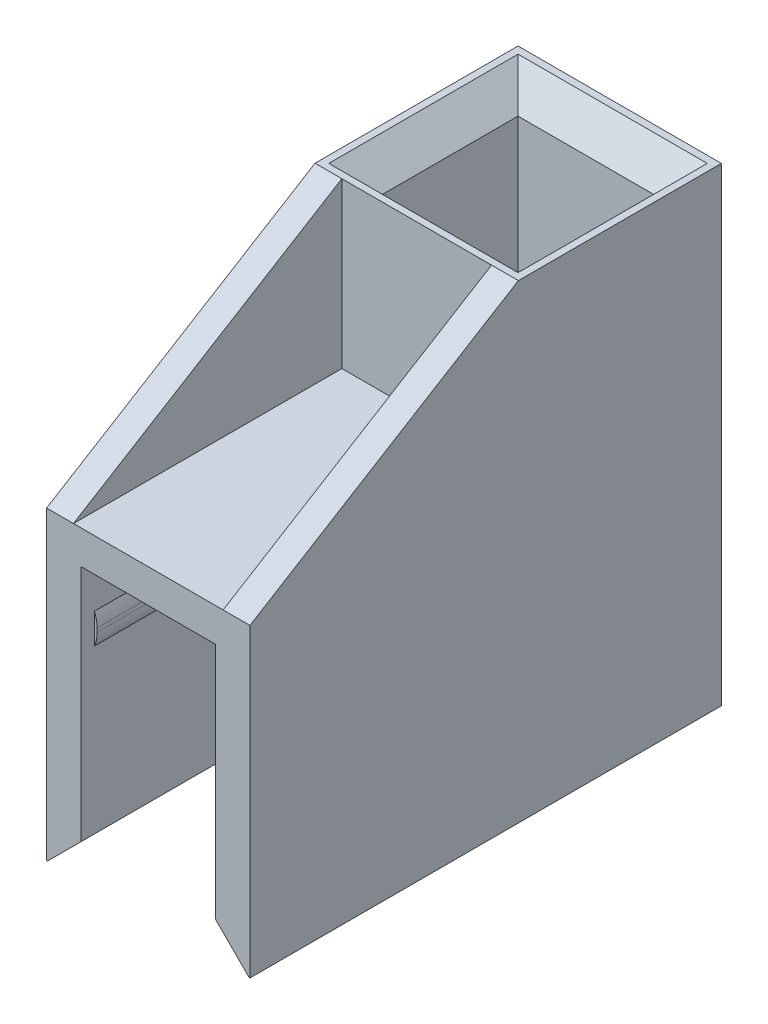
from build123d import *

# Parameters (mm, degrees)
CROQUIS2_W               = 30.3
CROQUIS2_H               = 70
SALIENTE_EXTRUIR2_DEPTH  = 5
SALIENTE_EXTRUIR3_START  = -20
SALIENTE_EXTRUIR3_DEPTH  = 70
SALIENTE_EXTRUIR4_START  = -20
CROQUIS4_W               = 20.2
CROQUIS4_H               = 20.2
SALIENTE_EXTRUIR4_DEPTH  = 4
CHAFL_N4_SIZE            = 4
CROQUIS6_W               = 30.3
CROQUIS6_H               = 5
CROQUIS6_W_2             = 5.125
CROQUIS6_H_2             = 40.5
SALIENTE_EXTRUIR6_DEPTH  = 40
SALIENTE_EXTRUIR7_START  = -15.15
SALIENTE_EXTRUIR7_DEPTH  = 30.3
CROQUIS8_W               = 22.3
CROQUIS8_H               = 24.5
CORTAR_EXTRUIR1_DEPTH    = 40
CHAFL_N9_SIZE            = 5
SALIENTE_EXTRUIR9_DEPTH  = 0.4
REDONDEO3_R              = 5
SALIENTE_EXTRUIR10_DEPTH = 0.4
REDONDEO4_R              = 5


with BuildPart() as part:
    # Croquis2 → Saliente-Extruir2 (new body)
    with BuildSketch(Plane.XY):
        with Locations((0, 15)):
            Rectangle(CROQUIS2_W, CROQUIS2_H)
    extrude(amount=-SALIENTE_EXTRUIR2_DEPTH)

    # Croquis3 → Saliente-Extruir3 (add)
    with BuildSketch(Plane(origin=(0, 0, 0), x_dir=(1, 0, 0), z_dir=(0, 1, 0)).offset(SALIENTE_EXTRUIR3_START)):
        Polygon((-15.15, 30.25), (-15.15, 5), (-10.1, 5), (-10.1, 25.2), (10.1, 25.2), (10.1, 5), (15.15, 5), (15.15, 30.25), align=None)
    extrude(amount=SALIENTE_EXTRUIR3_DEPTH)

    # Croquis4 → Saliente-Extruir4 (add)
    with BuildSketch(Plane(origin=(0, 0, 0), x_dir=(1, 0, 0), z_dir=(0, 1, 0)).offset(SALIENTE_EXTRUIR4_START)):
        with Locations((0, 15.1)):
            Rectangle(CROQUIS4_W, CROQUIS4_H)
    extrude(amount=SALIENTE_EXTRUIR4_DEPTH)

    # Chaflán4
    chafl_n4_edges = [part.edges().sort_by_distance(p)[0] for p in [
        (0, 50, -5),
        (10.1, 50, -15.1),
        (0, 50, -25.2),
        (-10.1, 50, -15.1),
    ]]
    chamfer(chafl_n4_edges, length=CHAFL_N4_SIZE)

    # Croquis6 → Saliente-Extruir6 (add)
    with BuildSketch(Plane.XY):
        with Locations((0, 23)):
            Rectangle(CROQUIS6_W, CROQUIS6_H)
        with Locations((-12.5875, 0.25)):
            Rectangle(CROQUIS6_W_2, CROQUIS6_H_2)
        with Locations((12.5875, 0.25)):
            Rectangle(CROQUIS6_W_2, CROQUIS6_H_2)
    extrude(amount=SALIENTE_EXTRUIR6_DEPTH)

    # Croquis7 → Saliente-Extruir7 (add)
    with BuildSketch(Plane(origin=(0, 0, 0), x_dir=(0, 0, -1), z_dir=(1, 0, 0)).offset(SALIENTE_EXTRUIR7_START)):
        Polygon((-40, 25.5), (0, 50), (0, 25.5), align=None)
    extrude(amount=SALIENTE_EXTRUIR7_DEPTH)

    # Croquis8 → Cortar-Extruir1 (cut)
    with BuildSketch(Plane.XY):
        with Locations((0, 37.75)):
            Rectangle(CROQUIS8_W, CROQUIS8_H)
    extrude(amount=CORTAR_EXTRUIR1_DEPTH, mode=Mode.SUBTRACT)

    # Chaflán9
    chafl_n9_edges = [part.edges().sort_by_distance(p)[0] for p in [
        (0, -20, 0),
        (-10.025, -20, 20),
        (10.025, -20, 20),
    ]]
    chamfer(chafl_n9_edges, length=CHAFL_N9_SIZE)

    # Croquis22 → Saliente-Extruir9 (add)
    with BuildSketch(Plane(origin=(-10.025, 0, 0), x_dir=(0, 0, -1), z_dir=(1, 0, 0))):
        Polygon((-2, 13.75), (-10, 13.75), (-30, 13.75), (-38, 13.75), (-38, 9.25), (-30, 9.25), (-10, 9.25), (-2, 9.25), align=None)
    extrude(amount=SALIENTE_EXTRUIR9_DEPTH)

    # Redondeo3
    # the kernel refuses this fillet: 5 mm, written as the material it takes off along each edge
    with BuildSketch(Plane(origin=(-9.625, 9.25, 2), x_dir=(-1, 0, 0), z_dir=(0, 0, 1)), Plane(origin=(-9.625, 13.75, 42.898979486), x_dir=(-1, 0, 0), z_dir=(0, 0, -1))) as redondeo3_piece_1:
        with BuildLine():
            CenterArc((5, -1.959591794), REDONDEO3_R, 156.926081934, 23.073918066)
            Line((0, -1.959591794), (0, 0))
            Line((0, 0), (0.4, 0))
        make_face()
    extrude(amount=40.898979486, mode=Mode.SUBTRACT)

    # Croquis26 → Saliente-Extruir10 (add)
    with BuildSketch(Plane.ZY.offset(-10.025)):
        Polygon((10, 13.75), (2, 13.75), (2, 9.25), (10, 9.25), (30, 9.25), (38, 9.25), (38, 13.75), (30, 13.75), align=None)
    extrude(amount=SALIENTE_EXTRUIR10_DEPTH)

    # Redondeo4
    # the kernel refuses this fillet: 5 mm, written as the material it takes off along each edge
    with BuildSketch(Plane(origin=(9.625, 9.25, 42.898979486), x_dir=(1, 0, 0), z_dir=(0, 0, -1)), Plane(origin=(9.625, 13.75, 2), x_dir=(1, 0, 0), z_dir=(0, 0, 1))) as redondeo4_piece_1:
        with BuildLine():
            CenterArc((5, -1.959591794), REDONDEO4_R, 156.926081934, 23.073918066)
            Line((0, -1.959591794), (0, 0))
            Line((0, 0), (0.4, 0))
        make_face()
    extrude(amount=40.898979486, mode=Mode.SUBTRACT)


solid = part.part
